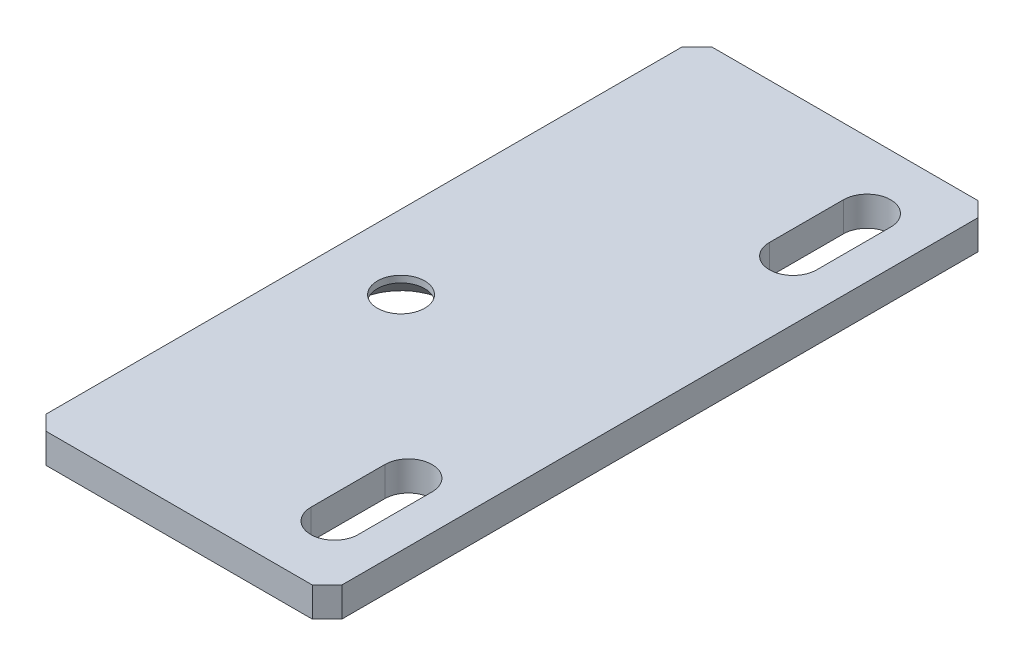
from build123d import *

# Parameters (mm, degrees)
SKETCH1_W        = 20
SKETCH1_H        = 45
BASE_DEPTH       = 2
SCREWSLOTS_DEPTH = 25.703238654
CHAMFER1_SIZE    = 1


with BuildPart() as part:
    # Sketch1 → Base (new body)
    with BuildSketch(Plane(origin=(0, 0, 0), x_dir=(1, 0, 0), z_dir=(0, 1, 0))):
        Rectangle(SKETCH1_W, SKETCH1_H)
    extrude(amount=BASE_DEPTH)

    # Sketch6 → ScrewSlots (cut, through all)
    with BuildSketch(Plane(origin=(0, 2, 0), x_dir=(1, 0, 0), z_dir=(0, 1, 0))):
        with BuildLine():
            Line((7.6, 18), (7.6, 13))
            ThreePointArc((7.6, 13), (6, 11.4), (4.4, 13))
            Line((4.4, 13), (4.4, 18))
            ThreePointArc((4.4, 18), (6, 19.6), (7.6, 18))
        make_face()
        with BuildLine():
            Line((7.6, -13), (7.6, -18))
            ThreePointArc((7.6, -18), (6, -19.6), (4.4, -18))
            Line((4.4, -18), (4.4, -13))
            ThreePointArc((4.4, -13), (6, -11.4), (7.6, -13))
        make_face()
    extrude(amount=-SCREWSLOTS_DEPTH, mode=Mode.SUBTRACT)

    # Sketch5 → PulleyHole (revolve, cut)
    with BuildSketch(Plane(origin=(-5, 0, 2.5), x_dir=(0, 0, -1), z_dir=(1, 0, 0))):
        Polygon((0, 0), (0, 2), (1.6, 2), (1.6, 1.55), (3.15, 0), align=None)
    revolve(axis=Axis((-5, -6.35, 2.5), (0, 1, 0)), mode=Mode.SUBTRACT)

    # Chamfer1
    chamfer1_edges = [part.edges().sort_by_distance(p)[0] for p in [
        (-10, 1, -22.5),
        (10, 1, -22.5),
        (10, 1, 22.5),
        (-10, 1, 22.5),
    ]]
    chamfer(chamfer1_edges, length=CHAMFER1_SIZE)


solid = part.part
